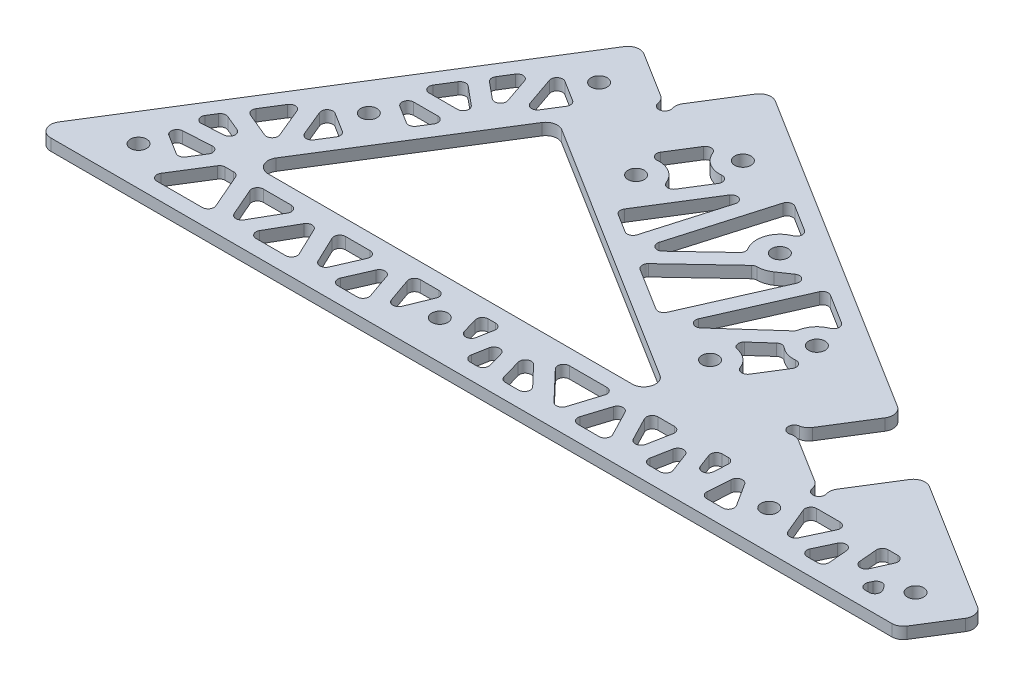
from build123d import *

# Parameters (mm, degrees)
SKETCH_1_R          = 2.1
EXTRUDE_1_DEPTH     = 3
FILLET_1_R          = 3
CUT_EXTRUDE_3_DEPTH = 10
FILLET_2_DEPTH      = 3


with BuildPart() as part:
    # 草图1 → 凸台-拉伸1 (new body)
    with BuildSketch(Plane(origin=(0, 0, 0), x_dir=(1, 0, 0), z_dir=(0, 1, 0))):
        with BuildLine():
            Line((42.513649836, 86.906860935), (37.214457193, 78.426379974))
            Line((37.214457193, 78.426379974), (-18.040477553, -10))
            Line((-18.040477553, -10), (162.722901053, -10))
            Line((162.722901053, -10), (206.007589864, -10))
            Line((206.007589864, -10), (214.244172953, 3.181288319))
            Line((214.244172953, 3.181288319), (176.079009063, 27.029529545))
            Line((176.079009063, 27.029529545), (166.301998638, 11.383042171))
            ThreePointArc((166.301998638, 11.383042171), (166.836284324, 10.820022533), (167.030623778, 10.068567622))
            ThreePointArc((167.030623778, 10.068567622), (165.053385877, 8.578611993), (164.166149229, 10.889942481))
            Line((164.166149229, 10.889942481), (149.834136404, 19.845578047))
            ThreePointArc((149.834136404, 19.845578047), (147.009388255, 20.318278772), (149.341036715, 21.981427455))
            Line((149.341036715, 21.981427455), (159.11804714, 37.627914829))
            Line((159.11804714, 37.627914829), (70.072997043, 93.269437574))
            Line((70.072997043, 93.269437574), (60.295986618, 77.6229502))
            ThreePointArc((60.295986618, 77.6229502), (60.830272305, 77.059930562), (61.024611759, 76.308475651))
            ThreePointArc((61.024611759, 76.308475651), (59.047373857, 74.818520022), (58.16013721, 77.12985051))
            Line((58.16013721, 77.12985051), (42.513649836, 86.906860935))
        make_face()
        with Locations(Location((0, 0, 0), (0, 0, 270))):
            Circle(SKETCH_1_R, mode=Mode.SUBTRACT)
        with Locations(Location((77.722901053, 0, 0), (0, 0, 270))):
            Circle(SKETCH_1_R, mode=Mode.SUBTRACT)
        with Locations(Location((22.847469077, 36.563593666, 0), (0, 0, 270))):
            Circle(SKETCH_1_R, mode=Mode.SUBTRACT)
        Polygon((48.876226474, 59.347513728), (127.848756615, 10), (18.040477553, 10), align=None, mode=Mode.SUBTRACT)
        with Locations(Location((162.722901053, 0, 0), (0, 0, 270))):
            Circle(SKETCH_1_R, mode=Mode.SUBTRACT)
        with Locations(Location((200.464499349, 0, 0), (0, 0, 270))):
            Circle(SKETCH_1_R, mode=Mode.SUBTRACT)
        with Locations(Location((122.019266809, 25.434453551, 0), (0, 0, 270))):
            Circle(SKETCH_1_R, mode=Mode.SUBTRACT)
        with Locations(Location((132.617652094, 42.395415474, 0), (0, 0, 270))):
            Circle(SKETCH_1_R, mode=Mode.SUBTRACT)
        with Locations(Location((71.13638104, 57.229609405, 0), (0, 0, 270))):
            Circle(SKETCH_1_R, mode=Mode.SUBTRACT)
        with Locations(Location((107.176209209, 58.292993401, 0), (0, 0, 270))):
            Circle(SKETCH_1_R, mode=Mode.SUBTRACT)
        with Locations(Location((45.694938155, 73.127187332, 0), (0, 0, 270))):
            Circle(SKETCH_1_R, mode=Mode.SUBTRACT)
        with Locations(Location((81.734766324, 74.190571328, 0), (0, 0, 270))):
            Circle(SKETCH_1_R, mode=Mode.SUBTRACT)
    extrude(amount=EXTRUDE_1_DEPTH)

    # 圆角1
    fillet_1_edges = [part.edges().sort_by_distance(p)[0] for p in [
        (127.848756615, 1.5, -10),
        (48.876226474, 1.5, -59.347513728),
        (18.040477553, 1.5, -10),
        (166.301998638, 1.5, -11.383042171),
        (176.079009063, 1.5, -27.029529545),
        (214.244172953, 1.5, -3.181288319),
        (206.007589864, 1.5, 10),
        (-18.040477553, 1.5, 10),
        (42.513649836, 1.5, -86.906860935),
        (58.16013721, 1.5, -77.12985051),
        (60.295986618, 1.5, -77.6229502),
        (70.072997043, 1.5, -93.269437574),
        (159.11804714, 1.5, -37.627914829),
        (149.341036715, 1.5, -21.981427455),
        (149.834136404, 1.5, -19.845578047),
        (164.166149229, 1.5, -10.889942481),
    ]]
    fillet(fillet_1_edges, radius=FILLET_1_R)

    # 草图2 → 切除-拉伸3 (cut)
    with BuildSketch(Plane(origin=(0, 3, 0), x_dir=(1, 0, 0), z_dir=(0, 1, 0))):
        with BuildLine():
            ThreePointArc((86.823054901, 71.011055742), (78.555250739, 69.102282751), (76.646477747, 77.370086913))
            Line((76.646477747, 77.370086913), (66.048092463, 60.40912499))
            ThreePointArc((66.048092463, 60.40912499), (72.790205174, 62.99717958), (77.13638104, 57.229609405))
            ThreePointArc((77.13638104, 57.229609405), (76.903951215, 55.57578527), (76.224669616, 54.050093819))
            Line((76.224669616, 54.050093819), (86.823054901, 71.011055742))
        make_face()
        Polygon((84.092247465, 42.058815128), (93.394762871, 73.979667262), (76.437346416, 46.842128185), align=None)
        with BuildLine():
            Line((110.355725131, 63.381281767), (96.919327421, 71.777274896))
            Line((96.919327421, 71.777274896), (87.616812015, 39.856422762))
            Line((87.616812015, 39.856422762), (102.810099374, 54.177524422))
            ThreePointArc((102.810099374, 54.177524422), (102.536242766, 62.097032229), (110.355725131, 63.381281767))
        make_face()
        with BuildLine():
            Line((105.108489413, 28.926409642), (118.152308726, 58.509435629))
            Line((118.152308726, 58.509435629), (110.553851127, 53.334008114))
            ThreePointArc((110.553851127, 53.334008114), (108.697593691, 52.489081853), (106.665549065, 52.314764046))
            Line((106.665549065, 52.314764046), (91.123678137, 37.665089601))
            Line((91.123678137, 37.665089601), (105.108489413, 28.926409642))
        make_face()
        with BuildLine():
            Line((135.797167679, 47.483704051), (121.579594162, 56.36783))
            Line((121.579594162, 56.36783), (108.53577485, 26.784804012))
            Line((108.53577485, 26.784804012), (126.648316539, 43.001247986))
            ThreePointArc((126.648316539, 43.001247986), (129.977789037, 47.783469208), (135.797167679, 47.483704051))
        make_face()
        with BuildLine():
            Line((127.107555386, 22.254937965), (137.705940671, 39.215899888))
            ThreePointArc((137.705940671, 39.215899888), (132.915931005, 36.402834253), (127.870250486, 38.726331395))
            Line((127.870250486, 38.726331395), (118.01706061, 29.904615242))
            ThreePointArc((118.01706061, 29.904615242), (124.467405164, 30.912283285), (128.019266809, 25.434453551))
            ThreePointArc((128.019266809, 25.434453551), (127.786836985, 23.780629416), (127.107555386, 22.254937965))
        make_face()
        Polygon((151.778336871, 6), (150.974032901, -6), (159.433596938, -6), (157.664543031, -3.226920221), align=None)
        Polygon((147.769362149, 6), (142.411969948, 6), (146.965058179, -6), align=None)
        Polygon((138.133722482, 6), (135.856280636, -6), (142.686810713, -6), align=None)
        Polygon((134.062321667, 6), (125.573241675, 6), (131.784879821, -6), align=None)
        Polygon((121.069114574, 6), (117.291890976, -6), (127.28075272, -6), align=None)
        Polygon((116.875635269, 6), (101.652246997, 6), (113.098411671, -6), align=None)
        Polygon((96.124391418, 6), (99.519054506, -6), (107.570556092, -6), align=None)
        Polygon((91.96741953, 6), (89.773561831, -6), (95.362082619, -6), align=None)
        Polygon((83.486047446, 1.669174542), (85.707263875, -6), (87.901121574, 6), (82.231714192, 6), align=None)
        Polygon((73.696209243, 6), (64.614897038, 6), (68.782559529, -6), (72.170358616, 2.273603415), align=None)
        Polygon((60.380521699, 6), (55.14016533, -6), (64.548184189, -6), align=None)
        Polygon((56.015746856, 6), (45.040036598, 6), (50.775390488, -6), align=None)
        Polygon((40.606649578, 6), (33.727970641, -6), (46.342003467, -6), align=None)
        Polygon((35.996079308, 6), (23.904213664, 6), (29.117400371, -6), align=None)
        Polygon((19.543055361, 6), (15.541000145, 6), (8.042567922, -6), (24.756242069, -6), align=None)
        Polygon((10.824286532, 6), (12.85183982, 9.244763536), (-1.908772992, 8.267804162), (3.179515476, 5.088288645), (8.267804162, 1.908772992), align=None)
        Polygon((15.464855539, 13.426462817), (4.235965092, 18.101440689), (0.704242728, 12.449503443), align=None)
        Polygon((17.613359946, 16.864788606), (11.975461446, 30.487223943), (6.384469499, 21.539766478), align=None)
        Polygon((19.667953409, 31.47530514), (14.579664915, 34.654820674), (20.217563415, 21.032385337), (24.756242069, 28.295789503), align=None)
        Polygon((31.11527324, 38.472366657), (35.088836926, 44.831397828), (20.938696086, 44.831397828), (26.026984702, 41.651882218), align=None)
        Polygon((37.588314334, 48.831397828), (28.259711222, 56.547471139), (23.438173494, 48.831397828), align=None)
        Polygon((39.726754508, 52.253617477), (34.699619263, 66.85347834), (30.398151396, 59.969690788), align=None)
        Polygon((42.515422381, 68.038898872), (37.427133992, 71.21841434), (42.454269238, 56.618553477), (47.603711146, 64.859383169), align=None)
        Polygon((177.355065851, 6), (166.72688198, 6), (168.263479741, 2.302604569), (171.713952873, -6), align=None)
        Polygon((181.77499742, 6), (176.133884442, -6), (182.78791461, -6), align=None)
        Polygon((192.19798653, 6), (185.789222144, 6), (186.802139334, -6), align=None)
        with BuildLine():
            Line((194.99226206, 2.460613551), (191.187913901, -6))
            Line((191.187913901, -6), (200.464499349, -6))
            ThreePointArc((200.464499349, -6), (195.426459983, -3.258551725), (194.99226206, 2.460613551))
        make_face()
    extrude(amount=-CUT_EXTRUDE_3_DEPTH, mode=Mode.SUBTRACT)

    # 圆角2: read off the stored shape, not the designer's step
    # 圆角2 outline → 圆角2 (add)
    with BuildSketch(Plane(origin=(0, 0, 0), x_dir=(1, 0, 0), z_dir=(0, 1, 0))):
        with BuildLine():
            ThreePointArc((189.878840168, 6), (191.138349977, 5.314637982), (191.24689954, 3.884846723))
            Line((191.24689954, 3.884846723), (192.19798653, 6))
            Line((192.19798653, 6), (189.878840168, 6))
        make_face()
        with BuildLine():
            Line((186.802139334, -6), (189.177669632, -0.716980941))
            ThreePointArc((189.177669632, -0.716980941), (187.557052082, -1.580412922), (186.314925629, -0.227993644))
            Line((186.314925629, -0.227993644), (186.802139334, -6))
        make_face()
        with BuildLine():
            ThreePointArc((185.926486434, 4.37383402), (186.316804963, 5.515074143), (187.421171064, 6))
            Line((187.421171064, 6), (185.789222144, 6))
            Line((185.789222144, 6), (185.926486434, 4.37383402))
        make_face()
        with BuildLine():
            ThreePointArc((182.65065032, -4.37383402), (182.26033179, -5.515074143), (181.155965689, -6))
            Line((181.155965689, -6), (182.78791461, -6))
            Line((182.78791461, -6), (182.65065032, -4.37383402))
        make_face()
        with BuildLine():
            Line((176.133884442, -6), (178.496497902, -6))
            ThreePointArc((178.496497902, -6), (177.230161208, -5.303984686), (177.139010822, -3.861855168))
            Line((177.139010822, -3.861855168), (176.133884442, -6))
        make_face()
        with BuildLine():
            ThreePointArc((179.393638148, 0.934277798), (181.016146696, 1.772535222), (182.24580986, 0.422298946))
            Line((182.24580986, 0.422298946), (181.77499742, 6))
            Line((181.77499742, 6), (179.393638148, 0.934277798))
        make_face()
        with BuildLine():
            ThreePointArc((195.664499349, -3.6), (195.806140136, -5.170820393), (194.464499349, -6))
            Line((194.464499349, -6), (200.464499349, -6))
            ThreePointArc((200.464499349, -6), (197.781217776, -5.366563146), (195.664499349, -3.6))
        make_face()
        with BuildLine():
            Line((191.187913901, -6), (193.507060263, -6))
            ThreePointArc((193.507060263, -6), (192.247550454, -5.314637982), (192.139000891, -3.884846723))
            Line((192.139000891, -3.884846723), (191.187913901, -6))
        make_face()
        with BuildLine():
            ThreePointArc((192.531648752, -3.011624379), (193.838103191, -2.128043246), (195.212666369, -2.901422125))
            ThreePointArc((195.212666369, -2.901422125), (194.469561709, -0.246419731), (194.992261861, 2.460613109))
            Line((194.992261861, 2.460613109), (192.531648752, -3.011624379))
        make_face()
        with BuildLine():
            ThreePointArc((174.992452391, 6), (176.258789085, 5.303984686), (176.349939471, 3.861855168))
            Line((176.349939471, 3.861855168), (177.355065851, 6))
            Line((177.355065851, 6), (174.992452391, 6))
        make_face()
        with BuildLine():
            Line((171.713952873, -6), (173.155872437, -2.932691327))
            ThreePointArc((173.155872437, -2.932691327), (171.764215218, -3.794157245), (170.413240713, -2.870197706))
            Line((170.413240713, -2.870197706), (171.713952873, -6))
        make_face()
        with BuildLine():
            ThreePointArc((167.589500292, 3.924348789), (167.7269517, 5.332623319), (168.974644935, 6))
            Line((168.974644935, 6), (166.72688198, 6))
            Line((166.72688198, 6), (167.589500292, 3.924348789))
        make_face()
        with BuildLine():
            ThreePointArc((63.856309682, -4.007877531), (63.661666126, -5.369429783), (62.439335626, -6))
            Line((62.439335626, -6), (64.548184189, -6))
            Line((64.548184189, -6), (63.856309682, -4.007877531))
        make_face()
        with BuildLine():
            Line((55.14016533, -6), (57.432000443, -6))
            ThreePointArc((57.432000443, -6), (56.176920501, -5.321446492), (56.057359089, -3.899699119))
            Line((56.057359089, -3.899699119), (55.14016533, -6))
        make_face()
        with BuildLine():
            ThreePointArc((58.846492615, 2.4871952), (60.279217156, 3.385769344), (61.638108025, 2.379016787))
            Line((61.638108025, 2.379016787), (60.380521699, 6))
            Line((60.380521699, 6), (58.846492615, 2.4871952))
        make_face()
        with BuildLine():
            ThreePointArc((71.461123862, 6), (72.706636102, 5.335882323), (72.849259415, 3.931599011))
            Line((72.849259415, 3.931599011), (73.696209243, 6))
            Line((73.696209243, 6), (71.461123862, 6))
        make_face()
        with BuildLine():
            Line((68.782559529, -6), (70.285993578, -2.328348653))
            ThreePointArc((70.285993578, -2.328348653), (68.857084037, -3.259393389), (67.480883968, -2.252070132))
            Line((67.480883968, -2.252070132), (68.782559529, -6))
        make_face()
        with BuildLine():
            ThreePointArc((65.306771545, 4.007877531), (65.501415101, 5.369429784), (66.723745602, 6))
            Line((66.723745602, 6), (64.614897038, 6))
            Line((64.614897038, 6), (65.306771545, 4.007877531))
        make_face()
        with BuildLine():
            ThreePointArc((86.102027628, 6), (87.254121719, 5.460561921), (87.577571246, 4.230238939))
            Line((87.577571246, 4.230238939), (87.901121574, 6))
            Line((87.901121574, 6), (86.102027628, 6))
        make_face()
        with BuildLine():
            Line((85.707263875, -6), (86.852314145, 0.26321536))
            ThreePointArc((86.852314145, 0.26321536), (85.452556333, -0.965107859), (83.935983968, 0.115682649))
            Line((83.935983968, 0.115682649), (85.707263875, -6))
        make_face()
        with BuildLine():
            ThreePointArc((82.787018339, 4.082706228), (83.028650892, 5.40112689), (84.227804898, 6))
            Line((84.227804898, 6), (82.231714192, 6))
            Line((82.231714192, 6), (82.787018339, 4.082706228))
        make_face()
        with BuildLine():
            ThreePointArc((105.152251524, -3.464683094), (105.445784073, -5.090349321), (104.066839665, -6))
            Line((104.066839665, -6), (107.570556092, -6))
            Line((107.570556092, -6), (105.152251524, -3.464683094))
        make_face()
        with BuildLine():
            Line((99.519054506, -6), (100.653586078, -6))
            ThreePointArc((100.653586078, -6), (99.74872819, -5.696341173), (99.210227749, -4.908309604))
            Line((99.210227749, -4.908309604), (99.519054506, -6))
        make_face()
        with BuildLine():
            ThreePointArc((97.771136439, 0.178821363), (98.470824281, 1.889802915), (100.299906627, 1.622447873))
            Line((100.299906627, 1.622447873), (96.124391418, 6))
            Line((96.124391418, 6), (97.771136439, 0.178821363))
        make_face()
        with BuildLine():
            ThreePointArc((132.25086613, 6), (133.406186783, 5.456678728), (133.724560388, 4.220312253))
            Line((133.724560388, 4.220312253), (134.062321667, 6))
            Line((134.062321667, 6), (132.25086613, 6))
        make_face()
        with BuildLine():
            Line((131.784879821, -6), (132.594536526, -1.733862327))
            ThreePointArc((132.594536526, -1.733862327), (131.337655777, -2.938422505), (129.788730659, -2.143724187))
            Line((129.788730659, -2.143724187), (131.784879821, -6))
        make_face()
        with BuildLine():
            ThreePointArc((126.706632497, 3.810450393), (126.757275337, 5.279639529), (128.038744106, 6))
            Line((128.038744106, 6), (125.573241675, 6))
            Line((125.573241675, 6), (126.706632497, 3.810450393))
        make_face()
        with BuildLine():
            ThreePointArc((113.821219767, 55.559463654), (115.625134634, 55.472692324), (116.038135688, 53.714548916))
            Line((116.038135688, 53.714548916), (118.152308726, 58.509435629))
            Line((118.152308726, 58.509435629), (113.821219767, 55.559463654))
        make_face()
        with BuildLine():
            Line((105.108489413, 28.926409642), (105.807191846, 30.51104768))
            ThreePointArc((105.807191846, 30.51104768), (104.87582499, 29.682550603), (103.639807508, 29.844143952))
            Line((103.639807508, 29.844143952), (105.108489413, 28.926409642))
        make_face()
        with BuildLine():
            ThreePointArc((106.20937532, 51.884777406), (106.67898876, 52.18509591), (107.225835894, 52.293198638))
            ThreePointArc((107.225835894, 52.293198638), (106.94544043, 52.297432896), (106.665549065, 52.314764046))
            Line((106.665549065, 52.314764046), (106.20937532, 51.884777406))
        make_face()
        with BuildLine():
            Line((91.123678137, 37.665089601), (92.772300797, 36.634915827))
            ThreePointArc((92.772300797, 36.634915827), (92.074476352, 37.759215401), (92.538312449, 38.99851543))
            Line((92.538312449, 38.99851543), (91.123678137, 37.665089601))
        make_face()
        with BuildLine():
            ThreePointArc((84.64668491, 43.961323744), (83.741118338, 42.97947422), (82.411712272, 43.108930065))
            Line((82.411712272, 43.108930065), (84.092247465, 42.058815128))
            Line((84.092247465, 42.058815128), (84.64668491, 43.961323744))
        make_face()
        with BuildLine():
            Line((76.437346416, 46.842128185), (77.70941856, 46.047249289))
            ThreePointArc((77.70941856, 46.047249289), (77.042742359, 46.981894852), (77.232225312, 48.11420033))
            Line((77.232225312, 48.11420033), (76.437346416, 46.842128185))
        make_face()
        with BuildLine():
            ThreePointArc((87.648918128, 64.784393522), (89.534052431, 65.358512357), (90.361084015, 63.569836161))
            Line((90.361084015, 63.569836161), (93.394762871, 73.979667262))
            Line((93.394762871, 73.979667262), (87.648918128, 64.784393522))
        make_face()
        with BuildLine():
            ThreePointArc((141.915775302, -3.967879282), (141.747872502, -5.352003205), (140.513331884, -6))
            Line((140.513331884, -6), (142.686810713, -6))
            Line((142.686810713, -6), (141.915775302, -3.967879282))
        make_face()
        with BuildLine():
            Line((135.856280636, -6), (137.667736172, -6))
            ThreePointArc((137.667736172, -6), (136.51241552, -5.456678728), (136.194041915, -4.220312253))
            Line((136.194041915, -4.220312253), (135.856280636, -6))
        make_face()
        with BuildLine():
            ThreePointArc((137.142823148, 0.778882269), (138.485369505, 1.993450266), (140.018960824, 1.03131524))
            Line((140.018960824, 1.03131524), (138.133722482, 6))
            Line((138.133722482, 6), (137.142823148, 0.778882269))
        make_face()
        with BuildLine():
            ThreePointArc((123.194072443, 31.318315524), (122.040755054, 32.394139776), (122.487222301, 33.90682144))
            Line((122.487222301, 33.90682144), (118.01706061, 29.904615242))
            ThreePointArc((118.01706061, 29.904615242), (120.438701843, 31.222528739), (123.194072443, 31.318315524))
        make_face()
        with BuildLine():
            Line((127.870250486, 38.726331395), (126.797872288, 37.766214296))
            ThreePointArc((126.797872288, 37.766214296), (127.774138733, 38.148477272), (128.762269489, 37.798022194))
            ThreePointArc((128.762269489, 37.798022194), (128.291289471, 38.238182445), (127.870250486, 38.726331395))
        make_face()
        with BuildLine():
            ThreePointArc((130.287070971, 27.343226542), (128.872925486, 26.644848875), (127.615852423, 27.597375061))
            ThreePointArc((127.615852423, 27.597375061), (127.992293065, 24.866160186), (127.107555386, 22.254937965))
            Line((127.107555386, 22.254937965), (130.287070971, 27.343226542))
        make_face()
        with BuildLine():
            ThreePointArc((137.705940671, 39.215899888), (135.746833155, 37.27601845), (133.127012771, 36.417075261))
            ThreePointArc((133.127012771, 36.417075261), (134.534202197, 35.704785473), (134.526425085, 34.127611311))
            Line((134.526425085, 34.127611311), (137.705940671, 39.215899888))
        make_face()
        with BuildLine():
            ThreePointArc((3.628263844, 12.64303537), (2.242013519, 13.369598022), (2.25712808, 14.934639491))
            Line((2.25712808, 14.934639491), (0.704242728, 12.449503443))
            Line((0.704242728, 12.449503443), (3.628263844, 12.64303537))
        make_face()
        with BuildLine():
            Line((4.235965092, 18.101440689), (3.561815101, 17.022575181))
            ThreePointArc((3.561815101, 17.022575181), (4.377883312, 17.656703077), (5.410418721, 17.612474771))
            Line((5.410418721, 17.612474771), (4.235965092, 18.101440689))
        make_face()
        with BuildLine():
            ThreePointArc((9.558589533, 15.8854469), (10.461880038, 14.255460529), (9.081121677, 13.003943188))
            Line((9.081121677, 13.003943188), (15.464855539, 13.426462817))
            Line((15.464855539, 13.426462817), (9.558589533, 15.8854469))
        make_face()
        with BuildLine():
            ThreePointArc((8.017238482, 20.859987928), (7.164763165, 21.788762482), (7.321697814, 23.039645311))
            Line((7.321697814, 23.039645311), (6.384469499, 21.539766478))
            Line((6.384469499, 21.539766478), (8.017238482, 20.859987928))
        make_face()
        with BuildLine():
            Line((11.975461446, 30.487223943), (10.431550314, 28.016449648))
            ThreePointArc((10.431550314, 28.016449648), (11.828054857, 28.716400701), (13.089610726, 27.795187802))
            Line((13.089610726, 27.795187802), (11.975461446, 30.487223943))
        make_face()
        with BuildLine():
            ThreePointArc((16.225553849, 20.218041386), (15.899109513, 18.582649098), (14.263034105, 18.259645849))
            Line((14.263034105, 18.259645849), (17.613359946, 16.864788606))
            Line((17.613359946, 16.864788606), (16.225553849, 20.218041386))
        make_face()
        with BuildLine():
            ThreePointArc((23.844940658, -3.902316272), (23.723457097, -5.322640385), (22.469159367, -6))
            Line((22.469159367, -6), (24.756242069, -6))
            Line((24.756242069, -6), (23.844940658, -3.902316272))
        make_face()
        with BuildLine():
            Line((8.042567922, -6), (10.748639555, -6))
            ThreePointArc((10.748639555, -6), (9.436709994, -5.227214431), (9.476567411, -3.705121104))
            Line((9.476567411, -3.705121104), (8.042567922, -6))
        make_face()
        with BuildLine():
            ThreePointArc((18.559269336, 6), (19.381909722, 5.75429773), (19.935050627, 5.097683728))
            Line((19.935050627, 5.097683728), (19.543055361, 6))
            Line((19.543055361, 6), (18.559269336, 6))
        make_face()
        with BuildLine():
            Line((15.541000145, 6), (15.100391578, 5.294878896))
            ThreePointArc((15.100391578, 5.294878896), (15.645249292, 5.811929561), (16.372463722, 6))
            Line((16.372463722, 6), (15.541000145, 6))
        make_face()
        with BuildLine():
            ThreePointArc((33.40728059, 6), (34.705154335, 5.252013126), (34.708638046, 3.754031656))
            Line((34.708638046, 3.754031656), (35.996079308, 6))
            Line((35.996079308, 6), (33.40728059, 6))
        make_face()
        with BuildLine():
            Line((29.117400371, -6), (30.603693437, -3.407130503))
            ThreePointArc((30.603693437, -3.407130503), (29.219379314, -4.158866467), (27.92655469, -3.258845888))
            Line((27.92655469, -3.258845888), (29.117400371, -6))
        make_face()
        with BuildLine():
            ThreePointArc((24.815515074, 3.902316272), (24.936998635, 5.322640385), (26.191296365, 6))
            Line((26.191296365, 6), (23.904213664, 6))
            Line((23.904213664, 6), (24.815515074, 3.902316272))
        make_face()
        with BuildLine():
            Line((47.603711146, 64.859383169), (46.331639002, 65.654262066))
            ThreePointArc((46.331639002, 65.654262066), (46.998315203, 64.719616503), (46.80883225, 63.587311025))
            Line((46.80883225, 63.587311025), (47.603711146, 64.859383169))
        make_face()
        with BuildLine():
            ThreePointArc((38.806198152, 67.213321206), (39.290704061, 68.875585673), (41.019354912, 68.973745582))
            Line((41.019354912, 68.973745582), (37.427133992, 71.21841434))
            Line((37.427133992, 71.21841434), (38.806198152, 67.213321206))
        make_face()
        with BuildLine():
            Line((42.454269238, 56.618553477), (44.1207675, 59.285508189))
            ThreePointArc((44.1207675, 59.285508189), (42.678890535, 58.590029302), (41.430417492, 59.592034854))
            Line((41.430417492, 59.592034854), (42.454269238, 56.618553477))
        make_face()
        with BuildLine():
            Line((35.088836926, 44.831397828), (32.382765293, 44.831397828))
            ThreePointArc((32.382765293, 44.831397828), (33.694694854, 44.058612259), (33.654837438, 42.536518932))
            Line((33.654837438, 42.536518932), (35.088836926, 44.831397828))
        make_face()
        with BuildLine():
            ThreePointArc((25.374938855, 42.059325684), (24.727925208, 43.744853862), (26.169817752, 44.831397828))
            Line((26.169817752, 44.831397828), (20.938696086, 44.831397828))
            Line((20.938696086, 44.831397828), (25.374938855, 42.059325684))
        make_face()
        with BuildLine():
            Line((31.11527324, 38.472366657), (31.910152136, 39.744438802))
            ThreePointArc((31.910152136, 39.744438802), (30.975506574, 39.077762601), (29.843201096, 39.267245554))
            Line((29.843201096, 39.267245554), (31.11527324, 38.472366657))
        make_face()
        with BuildLine():
            ThreePointArc((70.627020362, 63.207949617), (69.219830936, 63.920239405), (69.227608048, 65.497413567))
            Line((69.227608048, 65.497413567), (66.048092463, 60.40912499))
            ThreePointArc((66.048092463, 60.40912499), (68.007199978, 62.349006428), (70.627020362, 63.207949617))
        make_face()
        with BuildLine():
            Line((76.646477747, 77.370086913), (73.466962162, 72.281798336))
            ThreePointArc((73.466962162, 72.281798336), (74.881107648, 72.980176004), (76.13818071, 72.027649817))
            ThreePointArc((76.13818071, 72.027649817), (75.761740068, 74.758864692), (76.646477747, 77.370086913))
        make_face()
        with BuildLine():
            ThreePointArc((79.404185202, 59.138382396), (77.990039717, 58.440004729), (76.732966654, 59.392530915))
            ThreePointArc((76.732966654, 59.392530915), (77.109407295, 56.66131604), (76.224669616, 54.050093819))
            Line((76.224669616, 54.050093819), (79.404185202, 59.138382396))
        make_face()
        with BuildLine():
            ThreePointArc((86.823054901, 71.011055742), (84.863947386, 69.071174305), (82.244127002, 68.212231115))
            ThreePointArc((82.244127002, 68.212231115), (83.651316427, 67.499941327), (83.643539316, 65.922767165))
            Line((83.643539316, 65.922767165), (86.823054901, 71.011055742))
        make_face()
        with BuildLine():
            ThreePointArc((26.144245126, 48.831397828), (24.832315566, 49.604183398), (24.872172982, 51.126276724))
            Line((24.872172982, 51.126276724), (23.438173494, 48.831397828))
            Line((23.438173494, 48.831397828), (26.144245126, 48.831397828))
        make_face()
        with BuildLine():
            Line((28.259711222, 56.547471139), (27.351799402, 55.094508503))
            ThreePointArc((27.351799402, 55.094508503), (28.383992356, 55.780324705), (29.579917906, 55.455473608))
            Line((29.579917906, 55.455473608), (28.259711222, 56.547471139))
        make_face()
        with BuildLine():
            ThreePointArc((34.377443516, 51.48724183), (34.832738008, 49.823345667), (33.421397156, 48.831397828))
            Line((33.421397156, 48.831397828), (37.588314334, 48.831397828))
            Line((37.588314334, 48.831397828), (34.377443516, 51.48724183))
        make_face()
        with BuildLine():
            ThreePointArc((31.41009549, 59.13266999), (30.885446752, 60.048634802), (31.094069706, 61.083392889))
            Line((31.094069706, 61.083392889), (30.398151396, 59.969690788))
            Line((30.398151396, 59.969690788), (31.41009549, 59.13266999))
        make_face()
        with BuildLine():
            Line((34.699619263, 66.85347834), (33.033121001, 64.186523628))
            ThreePointArc((33.033121001, 64.186523628), (34.474997965, 64.882002515), (35.723471008, 63.879996964))
            Line((35.723471008, 63.879996964), (34.699619263, 66.85347834))
        make_face()
        with BuildLine():
            ThreePointArc((37.989644651, 57.29855082), (37.425333885, 55.577015635), (35.615320427, 55.654354587))
            Line((35.615320427, 55.654354587), (39.726754508, 52.253617477))
            Line((39.726754508, 52.253617477), (37.989644651, 57.29855082))
        make_face()
        with BuildLine():
            ThreePointArc((53.723911744, 6), (54.978991686, 5.321446492), (55.098553098, 3.899699119))
            Line((55.098553098, 3.899699119), (56.015746856, 6))
            Line((56.015746856, 6), (53.723911744, 6))
        make_face()
        with BuildLine():
            Line((50.775390488, -6), (52.088498222, -2.993087548))
            ThreePointArc((52.088498222, -2.993087548), (50.739440884, -3.89256847), (49.360489799, -3.039623257))
            Line((49.360489799, -3.039623257), (50.775390488, -6))
        make_face()
        with BuildLine():
            ThreePointArc((46.066108897, 3.853163409), (46.150567994, 5.299920344), (47.419475967, 6))
            Line((47.419475967, 6), (45.040036598, 6))
            Line((45.040036598, 6), (46.066108897, 3.853163409))
        make_face()
        with BuildLine():
            ThreePointArc((45.315931168, -3.853163409), (45.231472071, -5.299920344), (43.962564099, -6))
            Line((43.962564099, -6), (46.342003467, -6))
            Line((46.342003467, -6), (45.315931168, -3.853163409))
        make_face()
        with BuildLine():
            Line((33.727970641, -6), (36.316769359, -6))
            ThreePointArc((36.316769359, -6), (35.018895614, -5.252013126), (35.015411903, -3.754031656))
            Line((35.015411903, -3.754031656), (33.727970641, -6))
        make_face()
        with BuildLine():
            ThreePointArc((39.18481339, 3.519576882), (40.542144287, 4.272563833), (41.839537916, 3.420445129))
            Line((41.839537916, 3.420445129), (40.606649578, 6))
            Line((40.606649578, 6), (39.18481339, 3.519576882))
        make_face()
        with BuildLine():
            Line((24.756242069, 28.295789503), (23.484169925, 29.0906684))
            ThreePointArc((23.484169925, 29.0906684), (24.150846126, 28.156022837), (23.961363173, 27.023717359))
            Line((23.961363173, 27.023717359), (24.756242069, 28.295789503))
        make_face()
        with BuildLine():
            ThreePointArc((16.370735811, 30.327189118), (16.787706678, 32.045797556), (18.551602975, 32.172878313))
            Line((18.551602975, 32.172878313), (14.579664915, 34.654820674))
            Line((14.579664915, 34.654820674), (16.370735811, 30.327189118))
        make_face()
        with BuildLine():
            Line((20.217563415, 21.032385337), (21.761474547, 23.503159632))
            ThreePointArc((21.761474547, 23.503159632), (20.364970004, 22.803208579), (19.103414135, 23.724421478))
            Line((19.103414135, 23.724421478), (20.217563415, 21.032385337))
        make_face()
        with BuildLine():
            Line((12.85183982, 9.244763536), (9.927818704, 9.051231609))
            ThreePointArc((9.927818704, 9.051231609), (11.314069028, 8.324668957), (11.298954468, 6.759627488))
            Line((11.298954468, 6.759627488), (12.85183982, 9.244763536))
        make_face()
        with BuildLine():
            ThreePointArc((2.031200711, 5.805835348), (1.371313983, 7.443498762), (2.727015988, 8.574632717))
            Line((2.727015988, 8.574632717), (-1.908772992, 8.267804162))
            Line((-1.908772992, 8.267804162), (2.031200711, 5.805835348))
        make_face()
        with BuildLine():
            Line((8.267804162, 1.908772992), (9.062683059, 3.180845136))
            ThreePointArc((9.062683059, 3.180845136), (8.128037496, 2.514168935), (6.995732018, 2.703651888))
            Line((6.995732018, 2.703651888), (8.267804162, 1.908772992))
        make_face()
        with BuildLine():
            ThreePointArc((157.962045365, -3.693269893), (158.012768624, -5.221077263), (156.697455893, -6))
            Line((156.697455893, -6), (159.433596938, -6))
            Line((159.433596938, -6), (157.962045365, -3.693269893))
        make_face()
        with BuildLine():
            Line((150.974032901, -6), (152.577936417, -6))
            ThreePointArc((152.577936417, -6), (151.482384185, -5.524580551), (151.081294404, -4.399687074))
            Line((151.081294404, -4.399687074), (150.974032901, -6))
        make_face()
        with BuildLine():
            ThreePointArc((151.472963035, 1.443904095), (152.597827691, 2.796788195), (154.234194521, 2.150321276))
            Line((154.234194521, 2.150321276), (151.778336871, 6))
            Line((151.778336871, 6), (151.472963035, 1.443904095))
        make_face()
        with BuildLine():
            ThreePointArc((146.165458632, 6), (147.261010865, 5.524580551), (147.662100646, 4.399687074))
            Line((147.662100646, 4.399687074), (147.769362149, 6))
            Line((147.769362149, 6), (146.165458632, 6))
        make_face()
        with BuildLine():
            Line((146.965058179, -6), (147.424894156, 0.86062972))
            ThreePointArc((147.424894156, 0.86062972), (146.149233671, -0.52269045), (144.525808724, 0.428821928))
            Line((144.525808724, 0.428821928), (146.965058179, -6))
        make_face()
        with BuildLine():
            ThreePointArc((143.183005358, 3.967879282), (143.350908158, 5.352003205), (144.585448776, 6))
            Line((144.585448776, 6), (142.411969948, 6))
            Line((142.411969948, 6), (143.183005358, 3.967879282))
        make_face()
        with BuildLine():
            ThreePointArc((102.075218911, 55.133895748), (102.287271057, 54.149340581), (101.828838581, 53.252593876))
            Line((101.828838581, 53.252593876), (102.810099374, 54.177524422))
            ThreePointArc((102.810099374, 54.177524422), (102.418567171, 54.637197695), (102.075218911, 55.133895748))
        make_face()
        with BuildLine():
            Line((87.616812015, 39.856422762), (91.628038848, 43.637381148))
            ThreePointArc((91.628038848, 43.637381148), (89.816092652, 43.449538701), (89.159077861, 45.148587072))
            Line((89.159077861, 45.148587072), (87.616812015, 39.856422762))
        make_face()
        with BuildLine():
            ThreePointArc((105.267436217, 66.560797563), (105.965813885, 65.146652078), (105.013287699, 63.889579015))
            ThreePointArc((105.013287699, 63.889579015), (107.744502573, 64.266019656), (110.355724794, 63.381281978))
            Line((110.355724794, 63.381281978), (105.267436217, 66.560797563))
        make_face()
        with BuildLine():
            Line((96.919327421, 71.777274896), (96.364889976, 69.87476628))
            ThreePointArc((96.364889976, 69.87476628), (97.270456548, 70.856615804), (98.599862614, 70.727159959))
            Line((98.599862614, 70.727159959), (96.919327421, 71.777274896))
        make_face()
        with BuildLine():
            ThreePointArc((126.717135317, 43.483487977), (126.55004885, 43.021323411), (126.242557673, 42.63796568))
            Line((126.242557673, 42.63796568), (126.648316539, 43.001247986))
            ThreePointArc((126.648316539, 43.001247986), (126.677829921, 43.243066673), (126.717135317, 43.483487977))
        make_face()
        with BuildLine():
            Line((108.53577485, 26.784804012), (113.7116765, 31.418870317))
            ThreePointArc((113.7116765, 31.418870317), (111.829921875, 31.322540425), (111.338619509, 33.141579156))
            Line((111.338619509, 33.141579156), (108.53577485, 26.784804012))
        make_face()
        with BuildLine():
            ThreePointArc((130.708879102, 50.663219636), (131.40725677, 49.24907415), (130.454730583, 47.992001088))
            ThreePointArc((130.454730583, 47.992001088), (133.185945458, 48.36844173), (135.797167679, 47.483704051))
            Line((135.797167679, 47.483704051), (130.708879102, 50.663219636))
        make_face()
        with BuildLine():
            Line((121.579594162, 56.36783), (120.880891729, 54.783191962))
            ThreePointArc((120.880891729, 54.783191962), (121.812258585, 55.611689039), (123.048276067, 55.45009569))
            Line((123.048276067, 55.45009569), (121.579594162, 56.36783))
        make_face()
        with BuildLine():
            ThreePointArc((126.147361898, -3.810450393), (126.096719058, -5.279639529), (124.815250289, -6))
            Line((124.815250289, -6), (127.28075272, -6))
            Line((127.28075272, -6), (126.147361898, -3.810450393))
        make_face()
        with BuildLine():
            Line((117.291890976, -6), (119.336598665, -6))
            ThreePointArc((119.336598665, -6), (118.127145681, -5.387256152), (117.905805864, -4.049631306))
            Line((117.905805864, -4.049631306), (117.291890976, -6))
        make_face()
        with BuildLine():
            ThreePointArc((119.977522615, 2.532081524), (121.278946287, 3.576123626), (122.740427025, 2.771262436))
            Line((122.740427025, 2.771262436), (121.069114574, 6))
            Line((121.069114574, 6), (119.977522615, 2.532081524))
        make_face()
        with BuildLine():
            ThreePointArc((114.83092758, 6), (116.040380564, 5.387256152), (116.261720381, 4.049631306))
            Line((116.261720381, 4.049631306), (116.875635269, 6))
            Line((116.875635269, 6), (114.83092758, 6))
        make_face()
        with BuildLine():
            Line((113.098411671, -6), (113.861170499, -3.576763542))
            ThreePointArc((113.861170499, -3.576763542), (112.770029139, -4.587434511), (111.344965839, -4.161711754))
            Line((111.344965839, -4.161711754), (113.098411671, -6))
        make_face()
        with BuildLine():
            ThreePointArc((104.070551564, 3.464683094), (103.777019016, 5.090349321), (105.155963423, 6))
            Line((105.155963423, 6), (101.652246997, 6))
            Line((101.652246997, 6), (104.070551564, 3.464683094))
        make_face()
        with BuildLine():
            ThreePointArc((94.822243604, -4.091690396), (94.575226448, -5.404857888), (93.378885275, -6))
            Line((93.378885275, -6), (95.362082619, -6))
            Line((95.362082619, -6), (94.822243604, -4.091690396))
        make_face()
        with BuildLine():
            Line((89.773561831, -6), (91.572655777, -6))
            ThreePointArc((91.572655777, -6), (90.420561686, -5.460561921), (90.097112159, -4.230238939))
            Line((90.097112159, -4.230238939), (89.773561831, -6))
        make_face()
        with BuildLine():
            ThreePointArc((90.806174653, -0.351796898), (92.210599372, 0.876755127), (93.725076601, -0.213248355))
            Line((93.725076601, -0.213248355), (91.96741953, 6))
            Line((91.96741953, 6), (90.806174653, -0.351796898))
        make_face()
    extrude(amount=FILLET_2_DEPTH)


solid = part.part
